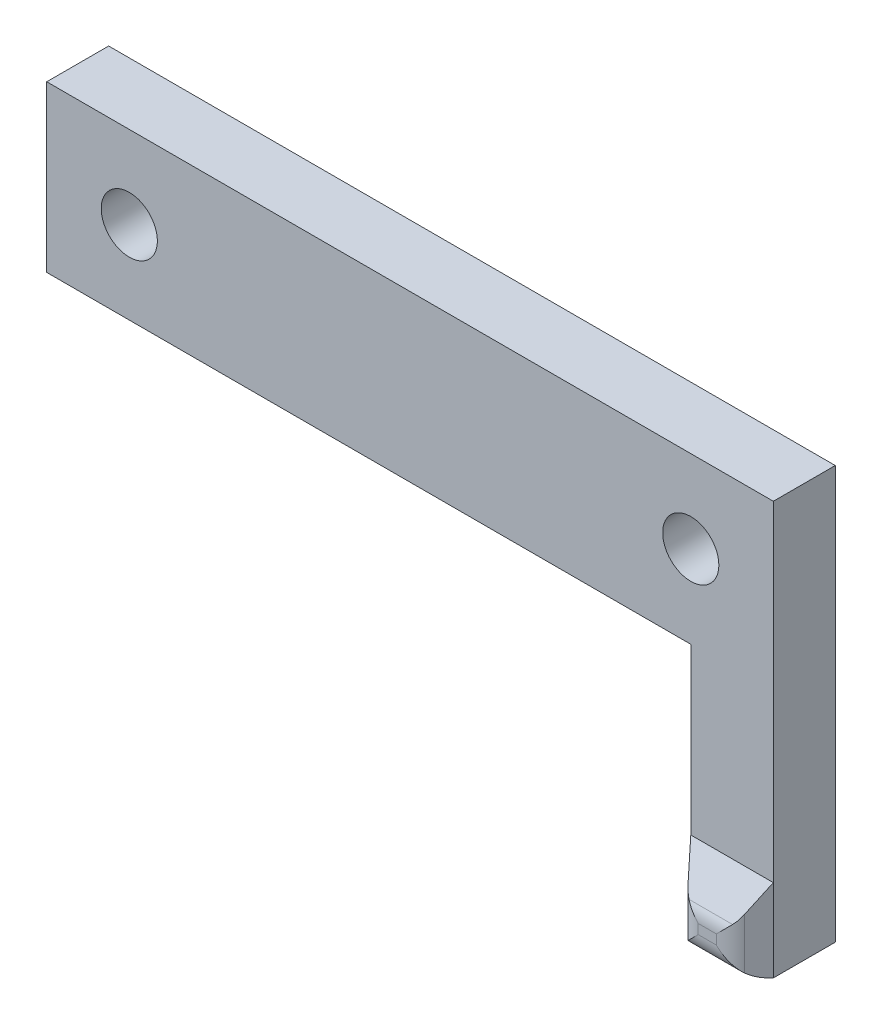
from build123d import *

# Parameters (mm, degrees)
SKETCH1_W           = 88
SKETCH1_H           = 20
SKETCH1_R           = 3.4
BOSS_EXTRUDE1_DEPTH = 7.5
SKETCH2_W           = 10
SKETCH2_H           = 7.5
BOSS_EXTRUDE2_DEPTH = 30
FILLET1_R           = 3


with BuildPart() as part:
    # Sketch1 → Boss-Extrude1 (new body)
    with BuildSketch(Plane.XY):
        with Locations((34, 0)):
            Rectangle(SKETCH1_W, SKETCH1_H)
        Circle(SKETCH1_R, mode=Mode.SUBTRACT)
        with Locations((68, 0)):
            Circle(SKETCH1_R, mode=Mode.SUBTRACT)
    extrude(amount=BOSS_EXTRUDE1_DEPTH)

    # Sketch2 → Boss-Extrude2 (add)
    with BuildSketch(Plane.XZ.offset(10)):
        with Locations((73, 3.75)):
            Rectangle(SKETCH2_W, SKETCH2_H)
    extrude(amount=BOSS_EXTRUDE2_DEPTH)

    # Sketch4 → Loft1 section 0
    with BuildSketch(Plane.XY.offset(7.5)):
        with BuildLine():
            Line((78, -40), (68, -40))
            Line((68, -40), (68, -30))
            Line((68, -30), (78, -30))
            Line((78, -30), (78, -40))
        make_face()
    # Sketch3 → Loft1 section 1
    with BuildSketch(Plane.XY.offset(10.5)):
        with BuildLine():
            Line((75.5, -35), (70.5, -35))
            Line((70.5, -35), (70.5, -40))
            Line((70.5, -40), (75.5, -40))
            Line((75.5, -40), (75.5, -35))
        make_face()
    loft()

    # Fillet1
    fillet1_edges = [part.edges().sort_by_distance(p)[0] for p in [
        (73, -35, 10.5),
        (75.5, -37.5, 10.5),
        (73, -40, 10.5),
        (70.5, -37.5, 10.5),
    ]]
    fillet(fillet1_edges, radius=FILLET1_R - 0.0001)  # a hair under: the kernel refuses the full size


solid = part.part
